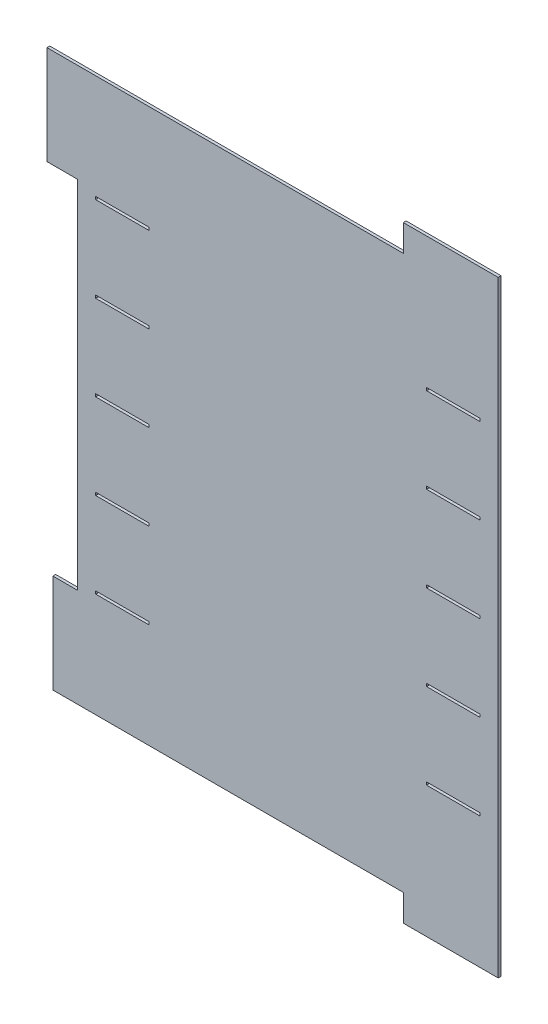
from build123d import *

# Parameters (mm, degrees)
SKETCH1_W               = 475.54896
SKETCH1_H               = 625.48516
BASE_FLANGE1_DEPTH      = 3.175
CUT_EXTRUDE1_DEPTH      = 393.880013884
CUT_EXTRUDE1_DEPTH_BACK = 393.880013884
SKETCH2_W               = 60.325
SKETCH2_H               = 3.175
SKETCH3_W               = 107.287119944
SKETCH3_H               = 30.1625
SKETCH3_W_2             = 34.47288
SKETCH3_H_2             = 111.597499944
SKETCH3_W_3             = 27.86888
BOSS_EXTRUDE1_DEPTH     = 3.175


# Sheet-metal steps are written as plain solids
with BuildPart() as part:
    # Sketch1 → Base-Flange1 (new body)
    with BuildSketch(Plane.XY):
        Rectangle(SKETCH1_W, SKETCH1_H)
    extrude(amount=-BASE_FLANGE1_DEPTH)

    # Sketch2 → Cut-Extrude1 (cut, two sides: drawn at the far end of the back side and taken through both)
    with BuildSketch(Plane.XY.offset(-CUT_EXTRUDE1_DEPTH_BACK)):
        with Locations((-186.97448, 96.52)):
            Rectangle(SKETCH2_W, SKETCH2_H)
        with Locations((-186.97448, 0)):
            Rectangle(SKETCH2_W, SKETCH2_H)
        with Locations((186.97448, 0)):
            Rectangle(SKETCH2_W, SKETCH2_H)
        with Locations((186.97448, 96.52)):
            Rectangle(SKETCH2_W, SKETCH2_H)
        with Locations((-186.97448, 193.04)):
            Rectangle(SKETCH2_W, SKETCH2_H)
        with Locations((186.97448, 193.04)):
            Rectangle(SKETCH2_W, SKETCH2_H)
        with Locations((-186.97448, -96.52)):
            Rectangle(SKETCH2_W, SKETCH2_H)
        with Locations((186.97448, -96.52)):
            Rectangle(SKETCH2_W, SKETCH2_H)
        with Locations((-186.97448, -193.04)):
            Rectangle(SKETCH2_W, SKETCH2_H)
        with Locations((186.97448, -193.04)):
            Rectangle(SKETCH2_W, SKETCH2_H)
    extrude(amount=CUT_EXTRUDE1_DEPTH + CUT_EXTRUDE1_DEPTH_BACK, mode=Mode.SUBTRACT)

    # Sketch3 → Boss-Extrude1 (add)
    with BuildSketch(Plane.XY):
        with Locations((184.130920028, 327.82383)):
            Rectangle(SKETCH3_W, SKETCH3_H)
        with Locations((-255.01092, 256.943830028)):
            Rectangle(SKETCH3_W_2, SKETCH3_H_2)
        with Locations((-251.70892, -256.943830028)):
            Rectangle(SKETCH3_W_3, SKETCH3_H_2)
        with Locations((184.130920028, -327.82383)):
            Rectangle(SKETCH3_W, SKETCH3_H)
    extrude(amount=-BOSS_EXTRUDE1_DEPTH)


solid = part.part
